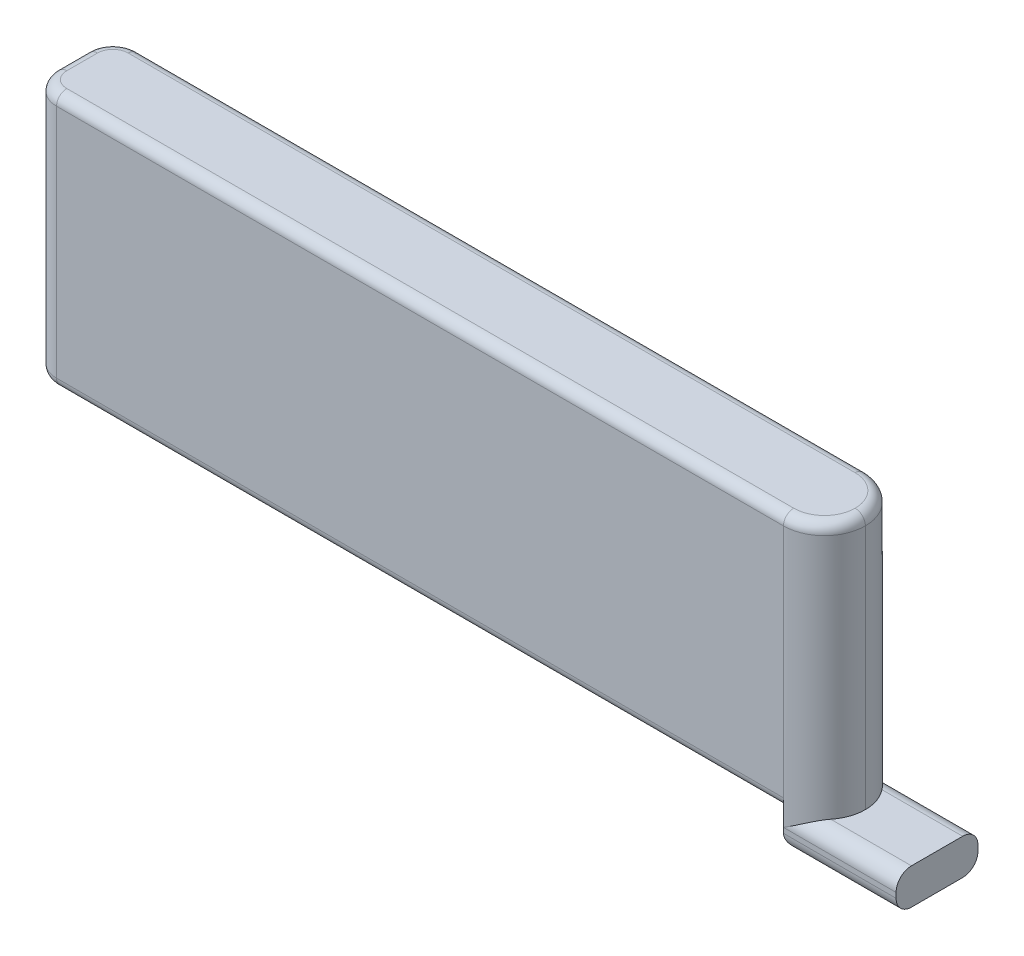
from build123d import *

# Parameters (mm, degrees)
CROQUIS1_W              = 155
CROQUIS1_H              = 50
SALIENTE_EXTRUIR1_DEPTH = 16
CROQUIS4_W              = 22
CROQUIS4_H              = 7
SALIENTE_EXTRUIR2_DEPTH = 16
REDONDEO1_R             = 3
REDONDEO2_R             = 5
REDONDEO3_START         = 92.156121327
REDONDEO3_DEPTH         = 8.0000001
REDONDEO4_R             = 2


with BuildPart() as part:
    # Croquis1 → Saliente-Extruir1 (new body)
    with BuildSketch(Plane.XY):
        with Locations((22.656121427, -3.145967168)):
            Rectangle(CROQUIS1_W, CROQUIS1_H)
    extrude(amount=SALIENTE_EXTRUIR1_DEPTH)

    # Croquis4 → Saliente-Extruir2 (add)
    with BuildSketch(Plane.XY.offset(16)):
        with Locations((103.156121427, -31.645967168)):
            Rectangle(CROQUIS4_W, CROQUIS4_H)
    extrude(amount=-SALIENTE_EXTRUIR2_DEPTH)

    # Redondeo1
    redondeo1_edges = [part.edges().sort_by_distance(p)[0] for p in [
        (107.156121427, -28.145967168, 16),
        (107.156121427, -28.145967168, 0),
        (103.156121427, -35.145967168, 16),
        (103.156121427, -35.145967168, 0),
        (92.156121427, -35.145967168, 8),
    ]]
    fillet(redondeo1_edges, radius=REDONDEO1_R)

    # Redondeo2
    redondeo2_edges = [part.edges().sort_by_distance(p)[0] for p in [
        (-54.843878573, -3.145967168, 0),
        (-54.843878573, -3.145967168, 16),
    ]]
    fillet(redondeo2_edges, radius=REDONDEO2_R)

    # Redondeo3: read off the stored shape, not the designer's step
    # Redondeo3 outline → Redondeo3 (cut)
    with BuildSketch(Plane.YZ.offset(REDONDEO3_START)):
        with BuildLine():
            Line((-28.145967168, 13), (-28.145967168, 3))
            ThreePointArc((-28.145967168, 3), (-29.024646824, 0.878679656), (-31.145967168, 0))
            Line((-31.145967168, 0), (21.854032832, 0))
            Line((21.854032832, 0), (21.854032832, 16))
            Line((21.854032832, 16), (-31.145967168, 16))
            ThreePointArc((-31.145967168, 16), (-29.024646824, 15.121320344), (-28.145967168, 13))
        make_face()
    extrude(amount=REDONDEO3_DEPTH, mode=Mode.SUBTRACT)

    # Redondeo3 2: loft between two sections, ruled curve by curve
    redondeo3_2_from = [
        Edge.make_three_point_arc((100.156121427, 21.854032832, 8), (97.812975677, 21.854032832, 13.656854249), (92.156121427, 21.854032832, 16)),
        Edge.make_three_point_arc((100.156121427, 21.854032832, 8), (97.812975677, 21.854032832, 2.343145751), (92.156121427, 21.854032832, 0)),
        Edge.make_line((92.156121427, 21.854032832, 0), (92.156121427, 21.854032832, 16)),
    ]
    redondeo3_2_to = [
        Edge.make_three_point_arc((100.156121427, -31.145967168, 8), (97.812975677, -31.145967168, 13.656854249), (92.156121427, -31.145967168, 16)),
        Edge.make_three_point_arc((100.156121427, -31.145967168, 8), (97.812975677, -31.145967168, 2.343145751), (92.156121427, -31.145967168, 0)),
        Edge.make_line((92.156121427, -31.145967168, 0), (92.156121427, -31.145967168, 16)),
    ]
    redondeo3_2 = Solid(Shell([*[Face.make_surface_from_curves(redondeo3_2_from[k], redondeo3_2_to[k]) for k in range(3)], Face(Wire(redondeo3_2_from)), Face(Wire(redondeo3_2_to))]))
    add(redondeo3_2)

    # Redondeo4
    redondeo4_edges = [part.edges().sort_by_distance(p)[0] for p in [
        (97.812975677, 21.854032832, 13.656854249),
        (97.812975677, 21.854032832, 2.343145751),
        (-53.379412479, 21.854032832, 1.464466094),
        (-54.843878573, 21.854032832, 8),
        (-53.379412479, 21.854032832, 14.535533906),
        (-53.379412479, -28.145967168, 1.464466094),
        (-54.843878573, -28.145967168, 8),
        (-53.379412479, -28.145967168, 14.535533906),
        (21.156121377, 21.854032832, 0),
        (21.156121377, 21.854032832, 16),
        (21.156121427, -28.145967168, 0),
        (21.156121427, -28.145967168, 16),
    ]]
    fillet(redondeo4_edges, radius=REDONDEO4_R)


solid = part.part
